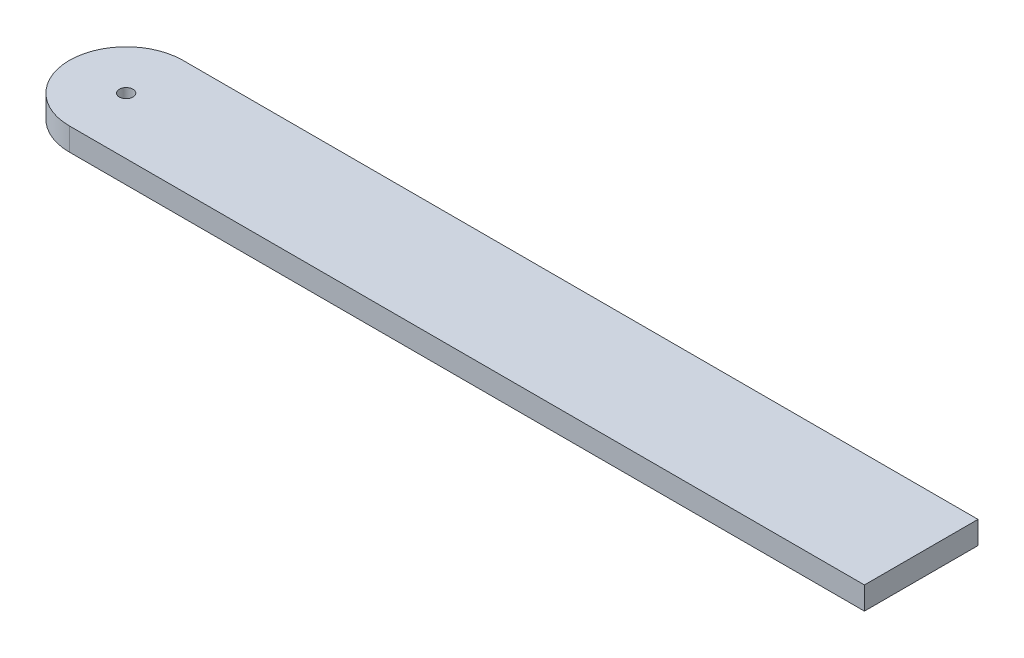
from build123d import *

# Parameters (mm, degrees)
BOSS_EXTRUDE1_DEPTH = 2
SKETCH2_R           = 0.6
CUT_EXTRUDE1_DEPTH  = 1.6


with BuildPart() as part:
    # Sketch1 → Boss-Extrude1 (new body)
    with BuildSketch(Plane(origin=(0, 0, 0), x_dir=(1, 0, 0), z_dir=(0, 1, 0))):
        with BuildLine():
            Line((70, 5), (0, 5))
            ThreePointArc((0, 5), (-5, 0), (0, -5))
            Line((0, -5), (70, -5))
            Line((70, -5), (70, 5))
        make_face()
    extrude(amount=BOSS_EXTRUDE1_DEPTH)

    # Sketch2 → Cut-Extrude1 (cut)
    with BuildSketch(Plane(origin=(0, 2, 0), x_dir=(1, 0, 0), z_dir=(0, 1, 0))):
        Circle(SKETCH2_R)
    extrude(amount=-CUT_EXTRUDE1_DEPTH, mode=Mode.SUBTRACT)


solid = part.part
